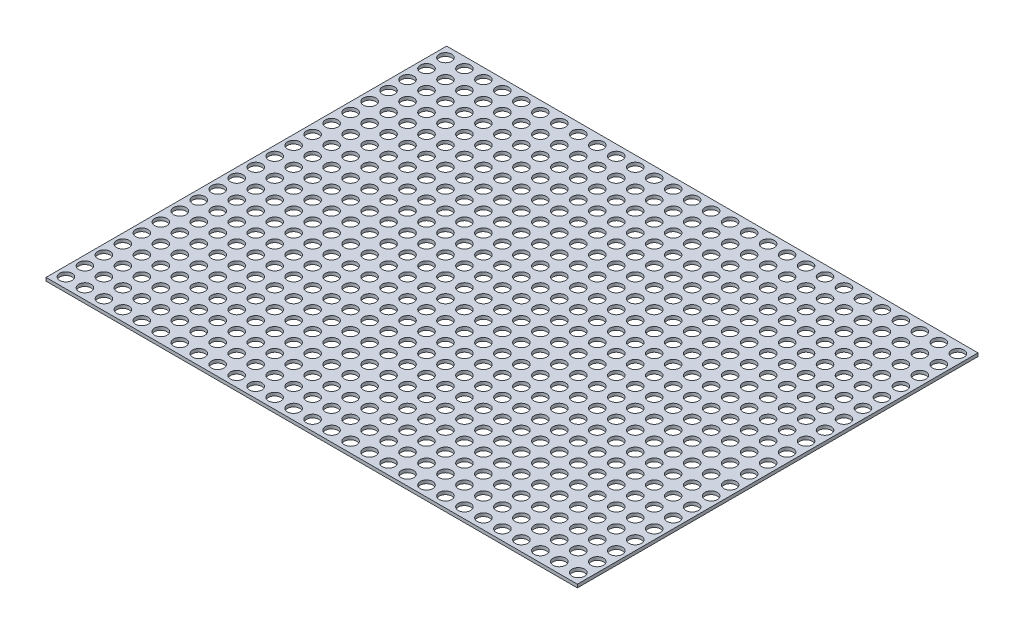
from build123d import *

# Parameters (mm, degrees)
SKETCH1_W           = 252
SKETCH1_H           = 190
SKETCH1_R           = 2.95
BOSS_EXTRUDE1_DEPTH = 1.55


with BuildPart() as part:
    # Sketch1 → Boss-Extrude1 (new body)
    with BuildSketch(Plane(origin=(0, 0, 0), x_dir=(1, 0, 0), z_dir=(0, 1, 0))):
        with Locations((126, 95)):
            Rectangle(SKETCH1_W, SKETCH1_H)
        with Locations((4.5, 4.95)):
            Circle(SKETCH1_R, mode=Mode.SUBTRACT)
        with Locations((13.5, 4.95)):
            Circle(SKETCH1_R, mode=Mode.SUBTRACT)
        with Locations((22.5, 4.95)):
            Circle(SKETCH1_R, mode=Mode.SUBTRACT)
        with Locations((4.5, 13.95)):
            Circle(SKETCH1_R, mode=Mode.SUBTRACT)
        with Locations((13.5, 13.95)):
            Circle(SKETCH1_R, mode=Mode.SUBTRACT)
        with Locations((4.5, 22.95)):
            Circle(SKETCH1_R, mode=Mode.SUBTRACT)
        with Locations((13.5, 22.95)):
            Circle(SKETCH1_R, mode=Mode.SUBTRACT)
        with Locations((22.5, 13.95)):
            Circle(SKETCH1_R, mode=Mode.SUBTRACT)
        with Locations((31.5, 13.95)):
            Circle(SKETCH1_R, mode=Mode.SUBTRACT)
        with Locations((22.5, 22.95)):
            Circle(SKETCH1_R, mode=Mode.SUBTRACT)
        with Locations((31.5, 22.95)):
            Circle(SKETCH1_R, mode=Mode.SUBTRACT)
        with Locations((31.5, 4.95)):
            Circle(SKETCH1_R, mode=Mode.SUBTRACT)
        with Locations((40.5, 4.95)):
            Circle(SKETCH1_R, mode=Mode.SUBTRACT)
        with Locations((49.5, 4.95)):
            Circle(SKETCH1_R, mode=Mode.SUBTRACT)
        with Locations((58.5, 4.95)):
            Circle(SKETCH1_R, mode=Mode.SUBTRACT)
        with Locations((40.5, 13.95)):
            Circle(SKETCH1_R, mode=Mode.SUBTRACT)
        with Locations((40.5, 22.95)):
            Circle(SKETCH1_R, mode=Mode.SUBTRACT)
        with Locations((49.5, 13.95)):
            Circle(SKETCH1_R, mode=Mode.SUBTRACT)
        with Locations((58.5, 13.95)):
            Circle(SKETCH1_R, mode=Mode.SUBTRACT)
        with Locations((49.5, 22.95)):
            Circle(SKETCH1_R, mode=Mode.SUBTRACT)
        with Locations((58.5, 22.95)):
            Circle(SKETCH1_R, mode=Mode.SUBTRACT)
        with Locations((4.5, 31.95)):
            Circle(SKETCH1_R, mode=Mode.SUBTRACT)
        with Locations((13.5, 31.95)):
            Circle(SKETCH1_R, mode=Mode.SUBTRACT)
        with Locations((22.5, 31.95)):
            Circle(SKETCH1_R, mode=Mode.SUBTRACT)
        with Locations((31.5, 31.95)):
            Circle(SKETCH1_R, mode=Mode.SUBTRACT)
        with Locations((4.5, 40.95)):
            Circle(SKETCH1_R, mode=Mode.SUBTRACT)
        with Locations((13.5, 40.95)):
            Circle(SKETCH1_R, mode=Mode.SUBTRACT)
        with Locations((22.5, 40.95)):
            Circle(SKETCH1_R, mode=Mode.SUBTRACT)
        with Locations((31.5, 40.95)):
            Circle(SKETCH1_R, mode=Mode.SUBTRACT)
        with Locations((40.5, 31.95)):
            Circle(SKETCH1_R, mode=Mode.SUBTRACT)
        with Locations((49.5, 31.95)):
            Circle(SKETCH1_R, mode=Mode.SUBTRACT)
        with Locations((58.5, 31.95)):
            Circle(SKETCH1_R, mode=Mode.SUBTRACT)
        with Locations((40.5, 40.95)):
            Circle(SKETCH1_R, mode=Mode.SUBTRACT)
        with Locations((49.5, 40.95)):
            Circle(SKETCH1_R, mode=Mode.SUBTRACT)
        with Locations((58.5, 40.95)):
            Circle(SKETCH1_R, mode=Mode.SUBTRACT)
        with Locations((67.5, 4.95)):
            Circle(SKETCH1_R, mode=Mode.SUBTRACT)
        with Locations((76.5, 4.95)):
            Circle(SKETCH1_R, mode=Mode.SUBTRACT)
        with Locations((85.5, 4.95)):
            Circle(SKETCH1_R, mode=Mode.SUBTRACT)
        with Locations((67.5, 13.95)):
            Circle(SKETCH1_R, mode=Mode.SUBTRACT)
        with Locations((76.5, 13.95)):
            Circle(SKETCH1_R, mode=Mode.SUBTRACT)
        with Locations((67.5, 22.95)):
            Circle(SKETCH1_R, mode=Mode.SUBTRACT)
        with Locations((76.5, 22.95)):
            Circle(SKETCH1_R, mode=Mode.SUBTRACT)
        with Locations((85.5, 13.95)):
            Circle(SKETCH1_R, mode=Mode.SUBTRACT)
        with Locations((94.5, 13.95)):
            Circle(SKETCH1_R, mode=Mode.SUBTRACT)
        with Locations((85.5, 22.95)):
            Circle(SKETCH1_R, mode=Mode.SUBTRACT)
        with Locations((94.5, 22.95)):
            Circle(SKETCH1_R, mode=Mode.SUBTRACT)
        with Locations((94.5, 4.95)):
            Circle(SKETCH1_R, mode=Mode.SUBTRACT)
        with Locations((103.5, 4.95)):
            Circle(SKETCH1_R, mode=Mode.SUBTRACT)
        with Locations((112.5, 4.95)):
            Circle(SKETCH1_R, mode=Mode.SUBTRACT)
        with Locations((121.5, 4.95)):
            Circle(SKETCH1_R, mode=Mode.SUBTRACT)
        with Locations((103.5, 13.95)):
            Circle(SKETCH1_R, mode=Mode.SUBTRACT)
        with Locations((103.5, 22.95)):
            Circle(SKETCH1_R, mode=Mode.SUBTRACT)
        with Locations((112.5, 13.95)):
            Circle(SKETCH1_R, mode=Mode.SUBTRACT)
        with Locations((121.5, 13.95)):
            Circle(SKETCH1_R, mode=Mode.SUBTRACT)
        with Locations((112.5, 22.95)):
            Circle(SKETCH1_R, mode=Mode.SUBTRACT)
        with Locations((121.5, 22.95)):
            Circle(SKETCH1_R, mode=Mode.SUBTRACT)
        with Locations((67.5, 31.95)):
            Circle(SKETCH1_R, mode=Mode.SUBTRACT)
        with Locations((76.5, 31.95)):
            Circle(SKETCH1_R, mode=Mode.SUBTRACT)
        with Locations((85.5, 31.95)):
            Circle(SKETCH1_R, mode=Mode.SUBTRACT)
        with Locations((94.5, 31.95)):
            Circle(SKETCH1_R, mode=Mode.SUBTRACT)
        with Locations((67.5, 40.95)):
            Circle(SKETCH1_R, mode=Mode.SUBTRACT)
        with Locations((76.5, 40.95)):
            Circle(SKETCH1_R, mode=Mode.SUBTRACT)
        with Locations((85.5, 40.95)):
            Circle(SKETCH1_R, mode=Mode.SUBTRACT)
        with Locations((94.5, 40.95)):
            Circle(SKETCH1_R, mode=Mode.SUBTRACT)
        with Locations((103.5, 31.95)):
            Circle(SKETCH1_R, mode=Mode.SUBTRACT)
        with Locations((112.5, 31.95)):
            Circle(SKETCH1_R, mode=Mode.SUBTRACT)
        with Locations((121.5, 31.95)):
            Circle(SKETCH1_R, mode=Mode.SUBTRACT)
        with Locations((103.5, 40.95)):
            Circle(SKETCH1_R, mode=Mode.SUBTRACT)
        with Locations((112.5, 40.95)):
            Circle(SKETCH1_R, mode=Mode.SUBTRACT)
        with Locations((121.5, 40.95)):
            Circle(SKETCH1_R, mode=Mode.SUBTRACT)
        with Locations((4.5, 49.95)):
            Circle(SKETCH1_R, mode=Mode.SUBTRACT)
        with Locations((13.5, 49.95)):
            Circle(SKETCH1_R, mode=Mode.SUBTRACT)
        with Locations((4.5, 58.95)):
            Circle(SKETCH1_R, mode=Mode.SUBTRACT)
        with Locations((13.5, 58.95)):
            Circle(SKETCH1_R, mode=Mode.SUBTRACT)
        with Locations((22.5, 49.95)):
            Circle(SKETCH1_R, mode=Mode.SUBTRACT)
        with Locations((31.5, 49.95)):
            Circle(SKETCH1_R, mode=Mode.SUBTRACT)
        with Locations((22.5, 58.95)):
            Circle(SKETCH1_R, mode=Mode.SUBTRACT)
        with Locations((31.5, 58.95)):
            Circle(SKETCH1_R, mode=Mode.SUBTRACT)
        with Locations((4.5, 67.95)):
            Circle(SKETCH1_R, mode=Mode.SUBTRACT)
        with Locations((13.5, 67.95)):
            Circle(SKETCH1_R, mode=Mode.SUBTRACT)
        with Locations((22.5, 67.95)):
            Circle(SKETCH1_R, mode=Mode.SUBTRACT)
        with Locations((31.5, 67.95)):
            Circle(SKETCH1_R, mode=Mode.SUBTRACT)
        with Locations((40.5, 49.95)):
            Circle(SKETCH1_R, mode=Mode.SUBTRACT)
        with Locations((40.5, 58.95)):
            Circle(SKETCH1_R, mode=Mode.SUBTRACT)
        with Locations((49.5, 49.95)):
            Circle(SKETCH1_R, mode=Mode.SUBTRACT)
        with Locations((58.5, 49.95)):
            Circle(SKETCH1_R, mode=Mode.SUBTRACT)
        with Locations((49.5, 58.95)):
            Circle(SKETCH1_R, mode=Mode.SUBTRACT)
        with Locations((58.5, 58.95)):
            Circle(SKETCH1_R, mode=Mode.SUBTRACT)
        with Locations((40.5, 67.95)):
            Circle(SKETCH1_R, mode=Mode.SUBTRACT)
        with Locations((49.5, 67.95)):
            Circle(SKETCH1_R, mode=Mode.SUBTRACT)
        with Locations((58.5, 67.95)):
            Circle(SKETCH1_R, mode=Mode.SUBTRACT)
        with Locations((4.5, 76.95)):
            Circle(SKETCH1_R, mode=Mode.SUBTRACT)
        with Locations((13.5, 76.95)):
            Circle(SKETCH1_R, mode=Mode.SUBTRACT)
        with Locations((22.5, 76.95)):
            Circle(SKETCH1_R, mode=Mode.SUBTRACT)
        with Locations((31.5, 76.95)):
            Circle(SKETCH1_R, mode=Mode.SUBTRACT)
        with Locations((4.5, 85.95)):
            Circle(SKETCH1_R, mode=Mode.SUBTRACT)
        with Locations((13.5, 85.95)):
            Circle(SKETCH1_R, mode=Mode.SUBTRACT)
        with Locations((4.5, 94.95)):
            Circle(SKETCH1_R, mode=Mode.SUBTRACT)
        with Locations((13.5, 94.95)):
            Circle(SKETCH1_R, mode=Mode.SUBTRACT)
        with Locations((22.5, 85.95)):
            Circle(SKETCH1_R, mode=Mode.SUBTRACT)
        with Locations((31.5, 85.95)):
            Circle(SKETCH1_R, mode=Mode.SUBTRACT)
        with Locations((22.5, 94.95)):
            Circle(SKETCH1_R, mode=Mode.SUBTRACT)
        with Locations((31.5, 94.95)):
            Circle(SKETCH1_R, mode=Mode.SUBTRACT)
        with Locations((40.5, 76.95)):
            Circle(SKETCH1_R, mode=Mode.SUBTRACT)
        with Locations((49.5, 76.95)):
            Circle(SKETCH1_R, mode=Mode.SUBTRACT)
        with Locations((58.5, 76.95)):
            Circle(SKETCH1_R, mode=Mode.SUBTRACT)
        with Locations((40.5, 85.95)):
            Circle(SKETCH1_R, mode=Mode.SUBTRACT)
        with Locations((40.5, 94.95)):
            Circle(SKETCH1_R, mode=Mode.SUBTRACT)
        with Locations((49.5, 85.95)):
            Circle(SKETCH1_R, mode=Mode.SUBTRACT)
        with Locations((58.5, 85.95)):
            Circle(SKETCH1_R, mode=Mode.SUBTRACT)
        with Locations((49.5, 94.95)):
            Circle(SKETCH1_R, mode=Mode.SUBTRACT)
        with Locations((58.5, 94.95)):
            Circle(SKETCH1_R, mode=Mode.SUBTRACT)
        with Locations((67.5, 49.95)):
            Circle(SKETCH1_R, mode=Mode.SUBTRACT)
        with Locations((76.5, 49.95)):
            Circle(SKETCH1_R, mode=Mode.SUBTRACT)
        with Locations((67.5, 58.95)):
            Circle(SKETCH1_R, mode=Mode.SUBTRACT)
        with Locations((76.5, 58.95)):
            Circle(SKETCH1_R, mode=Mode.SUBTRACT)
        with Locations((85.5, 49.95)):
            Circle(SKETCH1_R, mode=Mode.SUBTRACT)
        with Locations((94.5, 49.95)):
            Circle(SKETCH1_R, mode=Mode.SUBTRACT)
        with Locations((85.5, 58.95)):
            Circle(SKETCH1_R, mode=Mode.SUBTRACT)
        with Locations((94.5, 58.95)):
            Circle(SKETCH1_R, mode=Mode.SUBTRACT)
        with Locations((67.5, 67.95)):
            Circle(SKETCH1_R, mode=Mode.SUBTRACT)
        with Locations((76.5, 67.95)):
            Circle(SKETCH1_R, mode=Mode.SUBTRACT)
        with Locations((85.5, 67.95)):
            Circle(SKETCH1_R, mode=Mode.SUBTRACT)
        with Locations((94.5, 67.95)):
            Circle(SKETCH1_R, mode=Mode.SUBTRACT)
        with Locations((103.5, 49.95)):
            Circle(SKETCH1_R, mode=Mode.SUBTRACT)
        with Locations((103.5, 58.95)):
            Circle(SKETCH1_R, mode=Mode.SUBTRACT)
        with Locations((112.5, 49.95)):
            Circle(SKETCH1_R, mode=Mode.SUBTRACT)
        with Locations((121.5, 49.95)):
            Circle(SKETCH1_R, mode=Mode.SUBTRACT)
        with Locations((112.5, 58.95)):
            Circle(SKETCH1_R, mode=Mode.SUBTRACT)
        with Locations((121.5, 58.95)):
            Circle(SKETCH1_R, mode=Mode.SUBTRACT)
        with Locations((103.5, 67.95)):
            Circle(SKETCH1_R, mode=Mode.SUBTRACT)
        with Locations((112.5, 67.95)):
            Circle(SKETCH1_R, mode=Mode.SUBTRACT)
        with Locations((121.5, 67.95)):
            Circle(SKETCH1_R, mode=Mode.SUBTRACT)
        with Locations((67.5, 76.95)):
            Circle(SKETCH1_R, mode=Mode.SUBTRACT)
        with Locations((76.5, 76.95)):
            Circle(SKETCH1_R, mode=Mode.SUBTRACT)
        with Locations((85.5, 76.95)):
            Circle(SKETCH1_R, mode=Mode.SUBTRACT)
        with Locations((94.5, 76.95)):
            Circle(SKETCH1_R, mode=Mode.SUBTRACT)
        with Locations((67.5, 85.95)):
            Circle(SKETCH1_R, mode=Mode.SUBTRACT)
        with Locations((76.5, 85.95)):
            Circle(SKETCH1_R, mode=Mode.SUBTRACT)
        with Locations((67.5, 94.95)):
            Circle(SKETCH1_R, mode=Mode.SUBTRACT)
        with Locations((76.5, 94.95)):
            Circle(SKETCH1_R, mode=Mode.SUBTRACT)
        with Locations((85.5, 85.95)):
            Circle(SKETCH1_R, mode=Mode.SUBTRACT)
        with Locations((94.5, 85.95)):
            Circle(SKETCH1_R, mode=Mode.SUBTRACT)
        with Locations((85.5, 94.95)):
            Circle(SKETCH1_R, mode=Mode.SUBTRACT)
        with Locations((94.5, 94.95)):
            Circle(SKETCH1_R, mode=Mode.SUBTRACT)
        with Locations((103.5, 76.95)):
            Circle(SKETCH1_R, mode=Mode.SUBTRACT)
        with Locations((112.5, 76.95)):
            Circle(SKETCH1_R, mode=Mode.SUBTRACT)
        with Locations((121.5, 76.95)):
            Circle(SKETCH1_R, mode=Mode.SUBTRACT)
        with Locations((103.5, 85.95)):
            Circle(SKETCH1_R, mode=Mode.SUBTRACT)
        with Locations((103.5, 94.95)):
            Circle(SKETCH1_R, mode=Mode.SUBTRACT)
        with Locations((112.5, 85.95)):
            Circle(SKETCH1_R, mode=Mode.SUBTRACT)
        with Locations((121.5, 85.95)):
            Circle(SKETCH1_R, mode=Mode.SUBTRACT)
        with Locations((112.5, 94.95)):
            Circle(SKETCH1_R, mode=Mode.SUBTRACT)
        with Locations((121.5, 94.95)):
            Circle(SKETCH1_R, mode=Mode.SUBTRACT)
        with Locations((130.5, 4.95)):
            Circle(SKETCH1_R, mode=Mode.SUBTRACT)
        with Locations((139.5, 4.95)):
            Circle(SKETCH1_R, mode=Mode.SUBTRACT)
        with Locations((148.5, 4.95)):
            Circle(SKETCH1_R, mode=Mode.SUBTRACT)
        with Locations((130.5, 13.95)):
            Circle(SKETCH1_R, mode=Mode.SUBTRACT)
        with Locations((139.5, 13.95)):
            Circle(SKETCH1_R, mode=Mode.SUBTRACT)
        with Locations((130.5, 22.95)):
            Circle(SKETCH1_R, mode=Mode.SUBTRACT)
        with Locations((139.5, 22.95)):
            Circle(SKETCH1_R, mode=Mode.SUBTRACT)
        with Locations((148.5, 13.95)):
            Circle(SKETCH1_R, mode=Mode.SUBTRACT)
        with Locations((148.5, 22.95)):
            Circle(SKETCH1_R, mode=Mode.SUBTRACT)
        with Locations((157.5, 22.95)):
            Circle(SKETCH1_R, mode=Mode.SUBTRACT)
        with Locations((157.5, 4.95)):
            Circle(SKETCH1_R, mode=Mode.SUBTRACT)
        with Locations((166.5, 4.95)):
            Circle(SKETCH1_R, mode=Mode.SUBTRACT)
        with Locations((175.5, 4.95)):
            Circle(SKETCH1_R, mode=Mode.SUBTRACT)
        with Locations((184.5, 4.95)):
            Circle(SKETCH1_R, mode=Mode.SUBTRACT)
        with Locations((157.5, 13.95)):
            Circle(SKETCH1_R, mode=Mode.SUBTRACT)
        with Locations((166.5, 13.95)):
            Circle(SKETCH1_R, mode=Mode.SUBTRACT)
        with Locations((166.5, 22.95)):
            Circle(SKETCH1_R, mode=Mode.SUBTRACT)
        with Locations((175.5, 13.95)):
            Circle(SKETCH1_R, mode=Mode.SUBTRACT)
        with Locations((184.5, 13.95)):
            Circle(SKETCH1_R, mode=Mode.SUBTRACT)
        with Locations((175.5, 22.95)):
            Circle(SKETCH1_R, mode=Mode.SUBTRACT)
        with Locations((184.5, 22.95)):
            Circle(SKETCH1_R, mode=Mode.SUBTRACT)
        with Locations((130.5, 31.95)):
            Circle(SKETCH1_R, mode=Mode.SUBTRACT)
        with Locations((139.5, 31.95)):
            Circle(SKETCH1_R, mode=Mode.SUBTRACT)
        with Locations((148.5, 31.95)):
            Circle(SKETCH1_R, mode=Mode.SUBTRACT)
        with Locations((157.5, 31.95)):
            Circle(SKETCH1_R, mode=Mode.SUBTRACT)
        with Locations((130.5, 40.95)):
            Circle(SKETCH1_R, mode=Mode.SUBTRACT)
        with Locations((139.5, 40.95)):
            Circle(SKETCH1_R, mode=Mode.SUBTRACT)
        with Locations((148.5, 40.95)):
            Circle(SKETCH1_R, mode=Mode.SUBTRACT)
        with Locations((157.5, 40.95)):
            Circle(SKETCH1_R, mode=Mode.SUBTRACT)
        with Locations((166.5, 31.95)):
            Circle(SKETCH1_R, mode=Mode.SUBTRACT)
        with Locations((175.5, 31.95)):
            Circle(SKETCH1_R, mode=Mode.SUBTRACT)
        with Locations((184.5, 31.95)):
            Circle(SKETCH1_R, mode=Mode.SUBTRACT)
        with Locations((166.5, 40.95)):
            Circle(SKETCH1_R, mode=Mode.SUBTRACT)
        with Locations((175.5, 40.95)):
            Circle(SKETCH1_R, mode=Mode.SUBTRACT)
        with Locations((184.5, 40.95)):
            Circle(SKETCH1_R, mode=Mode.SUBTRACT)
        with Locations((193.5, 4.95)):
            Circle(SKETCH1_R, mode=Mode.SUBTRACT)
        with Locations((202.5, 4.95)):
            Circle(SKETCH1_R, mode=Mode.SUBTRACT)
        with Locations((211.5, 4.95)):
            Circle(SKETCH1_R, mode=Mode.SUBTRACT)
        with Locations((193.5, 13.95)):
            Circle(SKETCH1_R, mode=Mode.SUBTRACT)
        with Locations((202.5, 13.95)):
            Circle(SKETCH1_R, mode=Mode.SUBTRACT)
        with Locations((193.5, 22.95)):
            Circle(SKETCH1_R, mode=Mode.SUBTRACT)
        with Locations((202.5, 22.95)):
            Circle(SKETCH1_R, mode=Mode.SUBTRACT)
        with Locations((211.5, 13.95)):
            Circle(SKETCH1_R, mode=Mode.SUBTRACT)
        with Locations((211.5, 22.95)):
            Circle(SKETCH1_R, mode=Mode.SUBTRACT)
        with Locations((220.5, 22.95)):
            Circle(SKETCH1_R, mode=Mode.SUBTRACT)
        with Locations((220.5, 4.95)):
            Circle(SKETCH1_R, mode=Mode.SUBTRACT)
        with Locations((229.5, 4.95)):
            Circle(SKETCH1_R, mode=Mode.SUBTRACT)
        with Locations((238.5, 4.95)):
            Circle(SKETCH1_R, mode=Mode.SUBTRACT)
        with Locations((247.5, 4.95)):
            Circle(SKETCH1_R, mode=Mode.SUBTRACT)
        with Locations((220.5, 13.95)):
            Circle(SKETCH1_R, mode=Mode.SUBTRACT)
        with Locations((229.5, 13.95)):
            Circle(SKETCH1_R, mode=Mode.SUBTRACT)
        with Locations((229.5, 22.95)):
            Circle(SKETCH1_R, mode=Mode.SUBTRACT)
        with Locations((238.5, 13.95)):
            Circle(SKETCH1_R, mode=Mode.SUBTRACT)
        with Locations((247.5, 13.95)):
            Circle(SKETCH1_R, mode=Mode.SUBTRACT)
        with Locations((238.5, 22.95)):
            Circle(SKETCH1_R, mode=Mode.SUBTRACT)
        with Locations((247.5, 22.95)):
            Circle(SKETCH1_R, mode=Mode.SUBTRACT)
        with Locations((193.5, 31.95)):
            Circle(SKETCH1_R, mode=Mode.SUBTRACT)
        with Locations((202.5, 31.95)):
            Circle(SKETCH1_R, mode=Mode.SUBTRACT)
        with Locations((211.5, 31.95)):
            Circle(SKETCH1_R, mode=Mode.SUBTRACT)
        with Locations((220.5, 31.95)):
            Circle(SKETCH1_R, mode=Mode.SUBTRACT)
        with Locations((193.5, 40.95)):
            Circle(SKETCH1_R, mode=Mode.SUBTRACT)
        with Locations((202.5, 40.95)):
            Circle(SKETCH1_R, mode=Mode.SUBTRACT)
        with Locations((211.5, 40.95)):
            Circle(SKETCH1_R, mode=Mode.SUBTRACT)
        with Locations((220.5, 40.95)):
            Circle(SKETCH1_R, mode=Mode.SUBTRACT)
        with Locations((229.5, 31.95)):
            Circle(SKETCH1_R, mode=Mode.SUBTRACT)
        with Locations((238.5, 31.95)):
            Circle(SKETCH1_R, mode=Mode.SUBTRACT)
        with Locations((247.5, 31.95)):
            Circle(SKETCH1_R, mode=Mode.SUBTRACT)
        with Locations((229.5, 40.95)):
            Circle(SKETCH1_R, mode=Mode.SUBTRACT)
        with Locations((238.5, 40.95)):
            Circle(SKETCH1_R, mode=Mode.SUBTRACT)
        with Locations((247.5, 40.95)):
            Circle(SKETCH1_R, mode=Mode.SUBTRACT)
        with Locations((130.5, 49.95)):
            Circle(SKETCH1_R, mode=Mode.SUBTRACT)
        with Locations((139.5, 49.95)):
            Circle(SKETCH1_R, mode=Mode.SUBTRACT)
        with Locations((130.5, 58.95)):
            Circle(SKETCH1_R, mode=Mode.SUBTRACT)
        with Locations((139.5, 58.95)):
            Circle(SKETCH1_R, mode=Mode.SUBTRACT)
        with Locations((148.5, 49.95)):
            Circle(SKETCH1_R, mode=Mode.SUBTRACT)
        with Locations((157.5, 49.95)):
            Circle(SKETCH1_R, mode=Mode.SUBTRACT)
        with Locations((148.5, 58.95)):
            Circle(SKETCH1_R, mode=Mode.SUBTRACT)
        with Locations((157.5, 58.95)):
            Circle(SKETCH1_R, mode=Mode.SUBTRACT)
        with Locations((130.5, 67.95)):
            Circle(SKETCH1_R, mode=Mode.SUBTRACT)
        with Locations((139.5, 67.95)):
            Circle(SKETCH1_R, mode=Mode.SUBTRACT)
        with Locations((148.5, 67.95)):
            Circle(SKETCH1_R, mode=Mode.SUBTRACT)
        with Locations((157.5, 67.95)):
            Circle(SKETCH1_R, mode=Mode.SUBTRACT)
        with Locations((166.5, 49.95)):
            Circle(SKETCH1_R, mode=Mode.SUBTRACT)
        with Locations((166.5, 58.95)):
            Circle(SKETCH1_R, mode=Mode.SUBTRACT)
        with Locations((175.5, 49.95)):
            Circle(SKETCH1_R, mode=Mode.SUBTRACT)
        with Locations((184.5, 49.95)):
            Circle(SKETCH1_R, mode=Mode.SUBTRACT)
        with Locations((175.5, 58.95)):
            Circle(SKETCH1_R, mode=Mode.SUBTRACT)
        with Locations((184.5, 58.95)):
            Circle(SKETCH1_R, mode=Mode.SUBTRACT)
        with Locations((166.5, 67.95)):
            Circle(SKETCH1_R, mode=Mode.SUBTRACT)
        with Locations((175.5, 67.95)):
            Circle(SKETCH1_R, mode=Mode.SUBTRACT)
        with Locations((184.5, 67.95)):
            Circle(SKETCH1_R, mode=Mode.SUBTRACT)
        with Locations((130.5, 76.95)):
            Circle(SKETCH1_R, mode=Mode.SUBTRACT)
        with Locations((139.5, 76.95)):
            Circle(SKETCH1_R, mode=Mode.SUBTRACT)
        with Locations((148.5, 76.95)):
            Circle(SKETCH1_R, mode=Mode.SUBTRACT)
        with Locations((157.5, 76.95)):
            Circle(SKETCH1_R, mode=Mode.SUBTRACT)
        with Locations((130.5, 85.95)):
            Circle(SKETCH1_R, mode=Mode.SUBTRACT)
        with Locations((139.5, 85.95)):
            Circle(SKETCH1_R, mode=Mode.SUBTRACT)
        with Locations((130.5, 94.95)):
            Circle(SKETCH1_R, mode=Mode.SUBTRACT)
        with Locations((139.5, 94.95)):
            Circle(SKETCH1_R, mode=Mode.SUBTRACT)
        with Locations((148.5, 85.95)):
            Circle(SKETCH1_R, mode=Mode.SUBTRACT)
        with Locations((157.5, 85.95)):
            Circle(SKETCH1_R, mode=Mode.SUBTRACT)
        with Locations((148.5, 94.95)):
            Circle(SKETCH1_R, mode=Mode.SUBTRACT)
        with Locations((157.5, 94.95)):
            Circle(SKETCH1_R, mode=Mode.SUBTRACT)
        with Locations((166.5, 76.95)):
            Circle(SKETCH1_R, mode=Mode.SUBTRACT)
        with Locations((175.5, 76.95)):
            Circle(SKETCH1_R, mode=Mode.SUBTRACT)
        with Locations((184.5, 76.95)):
            Circle(SKETCH1_R, mode=Mode.SUBTRACT)
        with Locations((166.5, 85.95)):
            Circle(SKETCH1_R, mode=Mode.SUBTRACT)
        with Locations((166.5, 94.95)):
            Circle(SKETCH1_R, mode=Mode.SUBTRACT)
        with Locations((175.5, 85.95)):
            Circle(SKETCH1_R, mode=Mode.SUBTRACT)
        with Locations((184.5, 85.95)):
            Circle(SKETCH1_R, mode=Mode.SUBTRACT)
        with Locations((175.5, 94.95)):
            Circle(SKETCH1_R, mode=Mode.SUBTRACT)
        with Locations((184.5, 94.95)):
            Circle(SKETCH1_R, mode=Mode.SUBTRACT)
        with Locations((193.5, 49.95)):
            Circle(SKETCH1_R, mode=Mode.SUBTRACT)
        with Locations((202.5, 49.95)):
            Circle(SKETCH1_R, mode=Mode.SUBTRACT)
        with Locations((193.5, 58.95)):
            Circle(SKETCH1_R, mode=Mode.SUBTRACT)
        with Locations((202.5, 58.95)):
            Circle(SKETCH1_R, mode=Mode.SUBTRACT)
        with Locations((211.5, 49.95)):
            Circle(SKETCH1_R, mode=Mode.SUBTRACT)
        with Locations((220.5, 49.95)):
            Circle(SKETCH1_R, mode=Mode.SUBTRACT)
        with Locations((211.5, 58.95)):
            Circle(SKETCH1_R, mode=Mode.SUBTRACT)
        with Locations((220.5, 58.95)):
            Circle(SKETCH1_R, mode=Mode.SUBTRACT)
        with Locations((193.5, 67.95)):
            Circle(SKETCH1_R, mode=Mode.SUBTRACT)
        with Locations((202.5, 67.95)):
            Circle(SKETCH1_R, mode=Mode.SUBTRACT)
        with Locations((211.5, 67.95)):
            Circle(SKETCH1_R, mode=Mode.SUBTRACT)
        with Locations((220.5, 67.95)):
            Circle(SKETCH1_R, mode=Mode.SUBTRACT)
        with Locations((229.5, 49.95)):
            Circle(SKETCH1_R, mode=Mode.SUBTRACT)
        with Locations((229.5, 58.95)):
            Circle(SKETCH1_R, mode=Mode.SUBTRACT)
        with Locations((238.5, 49.95)):
            Circle(SKETCH1_R, mode=Mode.SUBTRACT)
        with Locations((247.5, 49.95)):
            Circle(SKETCH1_R, mode=Mode.SUBTRACT)
        with Locations((238.5, 58.95)):
            Circle(SKETCH1_R, mode=Mode.SUBTRACT)
        with Locations((247.5, 58.95)):
            Circle(SKETCH1_R, mode=Mode.SUBTRACT)
        with Locations((229.5, 67.95)):
            Circle(SKETCH1_R, mode=Mode.SUBTRACT)
        with Locations((238.5, 67.95)):
            Circle(SKETCH1_R, mode=Mode.SUBTRACT)
        with Locations((247.5, 67.95)):
            Circle(SKETCH1_R, mode=Mode.SUBTRACT)
        with Locations((193.5, 76.95)):
            Circle(SKETCH1_R, mode=Mode.SUBTRACT)
        with Locations((202.5, 76.95)):
            Circle(SKETCH1_R, mode=Mode.SUBTRACT)
        with Locations((211.5, 76.95)):
            Circle(SKETCH1_R, mode=Mode.SUBTRACT)
        with Locations((220.5, 76.95)):
            Circle(SKETCH1_R, mode=Mode.SUBTRACT)
        with Locations((193.5, 85.95)):
            Circle(SKETCH1_R, mode=Mode.SUBTRACT)
        with Locations((202.5, 85.95)):
            Circle(SKETCH1_R, mode=Mode.SUBTRACT)
        with Locations((193.5, 94.95)):
            Circle(SKETCH1_R, mode=Mode.SUBTRACT)
        with Locations((202.5, 94.95)):
            Circle(SKETCH1_R, mode=Mode.SUBTRACT)
        with Locations((211.5, 85.95)):
            Circle(SKETCH1_R, mode=Mode.SUBTRACT)
        with Locations((220.5, 85.95)):
            Circle(SKETCH1_R, mode=Mode.SUBTRACT)
        with Locations((211.5, 94.95)):
            Circle(SKETCH1_R, mode=Mode.SUBTRACT)
        with Locations((220.5, 94.95)):
            Circle(SKETCH1_R, mode=Mode.SUBTRACT)
        with Locations((229.5, 76.95)):
            Circle(SKETCH1_R, mode=Mode.SUBTRACT)
        with Locations((238.5, 76.95)):
            Circle(SKETCH1_R, mode=Mode.SUBTRACT)
        with Locations((247.5, 76.95)):
            Circle(SKETCH1_R, mode=Mode.SUBTRACT)
        with Locations((229.5, 85.95)):
            Circle(SKETCH1_R, mode=Mode.SUBTRACT)
        with Locations((229.5, 94.95)):
            Circle(SKETCH1_R, mode=Mode.SUBTRACT)
        with Locations((238.5, 85.95)):
            Circle(SKETCH1_R, mode=Mode.SUBTRACT)
        with Locations((247.5, 85.95)):
            Circle(SKETCH1_R, mode=Mode.SUBTRACT)
        with Locations((238.5, 94.95)):
            Circle(SKETCH1_R, mode=Mode.SUBTRACT)
        with Locations((247.5, 94.95)):
            Circle(SKETCH1_R, mode=Mode.SUBTRACT)
        with Locations((4.5, 103.95)):
            Circle(SKETCH1_R, mode=Mode.SUBTRACT)
        with Locations((13.5, 103.95)):
            Circle(SKETCH1_R, mode=Mode.SUBTRACT)
        with Locations((22.5, 103.95)):
            Circle(SKETCH1_R, mode=Mode.SUBTRACT)
        with Locations((31.5, 103.95)):
            Circle(SKETCH1_R, mode=Mode.SUBTRACT)
        with Locations((4.5, 112.95)):
            Circle(SKETCH1_R, mode=Mode.SUBTRACT)
        with Locations((13.5, 112.95)):
            Circle(SKETCH1_R, mode=Mode.SUBTRACT)
        with Locations((22.5, 112.95)):
            Circle(SKETCH1_R, mode=Mode.SUBTRACT)
        with Locations((31.5, 112.95)):
            Circle(SKETCH1_R, mode=Mode.SUBTRACT)
        with Locations((40.5, 103.95)):
            Circle(SKETCH1_R, mode=Mode.SUBTRACT)
        with Locations((49.5, 103.95)):
            Circle(SKETCH1_R, mode=Mode.SUBTRACT)
        with Locations((58.5, 103.95)):
            Circle(SKETCH1_R, mode=Mode.SUBTRACT)
        with Locations((40.5, 112.95)):
            Circle(SKETCH1_R, mode=Mode.SUBTRACT)
        with Locations((49.5, 112.95)):
            Circle(SKETCH1_R, mode=Mode.SUBTRACT)
        with Locations((58.5, 112.95)):
            Circle(SKETCH1_R, mode=Mode.SUBTRACT)
        with Locations((4.5, 121.95)):
            Circle(SKETCH1_R, mode=Mode.SUBTRACT)
        with Locations((13.5, 121.95)):
            Circle(SKETCH1_R, mode=Mode.SUBTRACT)
        with Locations((22.5, 121.95)):
            Circle(SKETCH1_R, mode=Mode.SUBTRACT)
        with Locations((31.5, 121.95)):
            Circle(SKETCH1_R, mode=Mode.SUBTRACT)
        with Locations((4.5, 130.95)):
            Circle(SKETCH1_R, mode=Mode.SUBTRACT)
        with Locations((13.5, 130.95)):
            Circle(SKETCH1_R, mode=Mode.SUBTRACT)
        with Locations((4.5, 139.95)):
            Circle(SKETCH1_R, mode=Mode.SUBTRACT)
        with Locations((13.5, 139.95)):
            Circle(SKETCH1_R, mode=Mode.SUBTRACT)
        with Locations((22.5, 130.95)):
            Circle(SKETCH1_R, mode=Mode.SUBTRACT)
        with Locations((31.5, 130.95)):
            Circle(SKETCH1_R, mode=Mode.SUBTRACT)
        with Locations((22.5, 139.95)):
            Circle(SKETCH1_R, mode=Mode.SUBTRACT)
        with Locations((31.5, 139.95)):
            Circle(SKETCH1_R, mode=Mode.SUBTRACT)
        with Locations((40.5, 121.95)):
            Circle(SKETCH1_R, mode=Mode.SUBTRACT)
        with Locations((49.5, 121.95)):
            Circle(SKETCH1_R, mode=Mode.SUBTRACT)
        with Locations((58.5, 121.95)):
            Circle(SKETCH1_R, mode=Mode.SUBTRACT)
        with Locations((40.5, 130.95)):
            Circle(SKETCH1_R, mode=Mode.SUBTRACT)
        with Locations((40.5, 139.95)):
            Circle(SKETCH1_R, mode=Mode.SUBTRACT)
        with Locations((49.5, 130.95)):
            Circle(SKETCH1_R, mode=Mode.SUBTRACT)
        with Locations((58.5, 130.95)):
            Circle(SKETCH1_R, mode=Mode.SUBTRACT)
        with Locations((49.5, 139.95)):
            Circle(SKETCH1_R, mode=Mode.SUBTRACT)
        with Locations((58.5, 139.95)):
            Circle(SKETCH1_R, mode=Mode.SUBTRACT)
        with Locations((67.5, 103.95)):
            Circle(SKETCH1_R, mode=Mode.SUBTRACT)
        with Locations((76.5, 103.95)):
            Circle(SKETCH1_R, mode=Mode.SUBTRACT)
        with Locations((85.5, 103.95)):
            Circle(SKETCH1_R, mode=Mode.SUBTRACT)
        with Locations((94.5, 103.95)):
            Circle(SKETCH1_R, mode=Mode.SUBTRACT)
        with Locations((67.5, 112.95)):
            Circle(SKETCH1_R, mode=Mode.SUBTRACT)
        with Locations((76.5, 112.95)):
            Circle(SKETCH1_R, mode=Mode.SUBTRACT)
        with Locations((85.5, 112.95)):
            Circle(SKETCH1_R, mode=Mode.SUBTRACT)
        with Locations((94.5, 112.95)):
            Circle(SKETCH1_R, mode=Mode.SUBTRACT)
        with Locations((103.5, 103.95)):
            Circle(SKETCH1_R, mode=Mode.SUBTRACT)
        with Locations((112.5, 103.95)):
            Circle(SKETCH1_R, mode=Mode.SUBTRACT)
        with Locations((121.5, 103.95)):
            Circle(SKETCH1_R, mode=Mode.SUBTRACT)
        with Locations((103.5, 112.95)):
            Circle(SKETCH1_R, mode=Mode.SUBTRACT)
        with Locations((112.5, 112.95)):
            Circle(SKETCH1_R, mode=Mode.SUBTRACT)
        with Locations((121.5, 112.95)):
            Circle(SKETCH1_R, mode=Mode.SUBTRACT)
        with Locations((67.5, 121.95)):
            Circle(SKETCH1_R, mode=Mode.SUBTRACT)
        with Locations((76.5, 121.95)):
            Circle(SKETCH1_R, mode=Mode.SUBTRACT)
        with Locations((85.5, 121.95)):
            Circle(SKETCH1_R, mode=Mode.SUBTRACT)
        with Locations((94.5, 121.95)):
            Circle(SKETCH1_R, mode=Mode.SUBTRACT)
        with Locations((67.5, 130.95)):
            Circle(SKETCH1_R, mode=Mode.SUBTRACT)
        with Locations((76.5, 130.95)):
            Circle(SKETCH1_R, mode=Mode.SUBTRACT)
        with Locations((67.5, 139.95)):
            Circle(SKETCH1_R, mode=Mode.SUBTRACT)
        with Locations((76.5, 139.95)):
            Circle(SKETCH1_R, mode=Mode.SUBTRACT)
        with Locations((85.5, 130.95)):
            Circle(SKETCH1_R, mode=Mode.SUBTRACT)
        with Locations((94.5, 130.95)):
            Circle(SKETCH1_R, mode=Mode.SUBTRACT)
        with Locations((85.5, 139.95)):
            Circle(SKETCH1_R, mode=Mode.SUBTRACT)
        with Locations((94.5, 139.95)):
            Circle(SKETCH1_R, mode=Mode.SUBTRACT)
        with Locations((103.5, 121.95)):
            Circle(SKETCH1_R, mode=Mode.SUBTRACT)
        with Locations((112.5, 121.95)):
            Circle(SKETCH1_R, mode=Mode.SUBTRACT)
        with Locations((121.5, 121.95)):
            Circle(SKETCH1_R, mode=Mode.SUBTRACT)
        with Locations((103.5, 130.95)):
            Circle(SKETCH1_R, mode=Mode.SUBTRACT)
        with Locations((103.5, 139.95)):
            Circle(SKETCH1_R, mode=Mode.SUBTRACT)
        with Locations((112.5, 130.95)):
            Circle(SKETCH1_R, mode=Mode.SUBTRACT)
        with Locations((121.5, 130.95)):
            Circle(SKETCH1_R, mode=Mode.SUBTRACT)
        with Locations((112.5, 139.95)):
            Circle(SKETCH1_R, mode=Mode.SUBTRACT)
        with Locations((121.5, 139.95)):
            Circle(SKETCH1_R, mode=Mode.SUBTRACT)
        with Locations((4.5, 148.95)):
            Circle(SKETCH1_R, mode=Mode.SUBTRACT)
        with Locations((13.5, 148.95)):
            Circle(SKETCH1_R, mode=Mode.SUBTRACT)
        with Locations((22.5, 148.95)):
            Circle(SKETCH1_R, mode=Mode.SUBTRACT)
        with Locations((31.5, 148.95)):
            Circle(SKETCH1_R, mode=Mode.SUBTRACT)
        with Locations((4.5, 157.95)):
            Circle(SKETCH1_R, mode=Mode.SUBTRACT)
        with Locations((13.5, 157.95)):
            Circle(SKETCH1_R, mode=Mode.SUBTRACT)
        with Locations((22.5, 157.95)):
            Circle(SKETCH1_R, mode=Mode.SUBTRACT)
        with Locations((31.5, 157.95)):
            Circle(SKETCH1_R, mode=Mode.SUBTRACT)
        with Locations((40.5, 148.95)):
            Circle(SKETCH1_R, mode=Mode.SUBTRACT)
        with Locations((49.5, 148.95)):
            Circle(SKETCH1_R, mode=Mode.SUBTRACT)
        with Locations((58.5, 148.95)):
            Circle(SKETCH1_R, mode=Mode.SUBTRACT)
        with Locations((40.5, 157.95)):
            Circle(SKETCH1_R, mode=Mode.SUBTRACT)
        with Locations((49.5, 157.95)):
            Circle(SKETCH1_R, mode=Mode.SUBTRACT)
        with Locations((58.5, 157.95)):
            Circle(SKETCH1_R, mode=Mode.SUBTRACT)
        with Locations((4.5, 166.95)):
            Circle(SKETCH1_R, mode=Mode.SUBTRACT)
        with Locations((13.5, 166.95)):
            Circle(SKETCH1_R, mode=Mode.SUBTRACT)
        with Locations((4.5, 175.95)):
            Circle(SKETCH1_R, mode=Mode.SUBTRACT)
        with Locations((13.5, 175.95)):
            Circle(SKETCH1_R, mode=Mode.SUBTRACT)
        with Locations((22.5, 166.95)):
            Circle(SKETCH1_R, mode=Mode.SUBTRACT)
        with Locations((31.5, 166.95)):
            Circle(SKETCH1_R, mode=Mode.SUBTRACT)
        with Locations((22.5, 175.95)):
            Circle(SKETCH1_R, mode=Mode.SUBTRACT)
        with Locations((31.5, 175.95)):
            Circle(SKETCH1_R, mode=Mode.SUBTRACT)
        with Locations((4.5, 184.95)):
            Circle(SKETCH1_R, mode=Mode.SUBTRACT)
        with Locations((13.5, 184.95)):
            Circle(SKETCH1_R, mode=Mode.SUBTRACT)
        with Locations((22.5, 184.95)):
            Circle(SKETCH1_R, mode=Mode.SUBTRACT)
        with Locations((31.5, 184.95)):
            Circle(SKETCH1_R, mode=Mode.SUBTRACT)
        with Locations((40.5, 166.95)):
            Circle(SKETCH1_R, mode=Mode.SUBTRACT)
        with Locations((40.5, 175.95)):
            Circle(SKETCH1_R, mode=Mode.SUBTRACT)
        with Locations((49.5, 166.95)):
            Circle(SKETCH1_R, mode=Mode.SUBTRACT)
        with Locations((58.5, 166.95)):
            Circle(SKETCH1_R, mode=Mode.SUBTRACT)
        with Locations((49.5, 175.95)):
            Circle(SKETCH1_R, mode=Mode.SUBTRACT)
        with Locations((58.5, 175.95)):
            Circle(SKETCH1_R, mode=Mode.SUBTRACT)
        with Locations((40.5, 184.95)):
            Circle(SKETCH1_R, mode=Mode.SUBTRACT)
        with Locations((49.5, 184.95)):
            Circle(SKETCH1_R, mode=Mode.SUBTRACT)
        with Locations((58.5, 184.95)):
            Circle(SKETCH1_R, mode=Mode.SUBTRACT)
        with Locations((67.5, 148.95)):
            Circle(SKETCH1_R, mode=Mode.SUBTRACT)
        with Locations((76.5, 148.95)):
            Circle(SKETCH1_R, mode=Mode.SUBTRACT)
        with Locations((85.5, 148.95)):
            Circle(SKETCH1_R, mode=Mode.SUBTRACT)
        with Locations((94.5, 148.95)):
            Circle(SKETCH1_R, mode=Mode.SUBTRACT)
        with Locations((67.5, 157.95)):
            Circle(SKETCH1_R, mode=Mode.SUBTRACT)
        with Locations((76.5, 157.95)):
            Circle(SKETCH1_R, mode=Mode.SUBTRACT)
        with Locations((85.5, 157.95)):
            Circle(SKETCH1_R, mode=Mode.SUBTRACT)
        with Locations((94.5, 157.95)):
            Circle(SKETCH1_R, mode=Mode.SUBTRACT)
        with Locations((103.5, 148.95)):
            Circle(SKETCH1_R, mode=Mode.SUBTRACT)
        with Locations((112.5, 148.95)):
            Circle(SKETCH1_R, mode=Mode.SUBTRACT)
        with Locations((121.5, 148.95)):
            Circle(SKETCH1_R, mode=Mode.SUBTRACT)
        with Locations((103.5, 157.95)):
            Circle(SKETCH1_R, mode=Mode.SUBTRACT)
        with Locations((112.5, 157.95)):
            Circle(SKETCH1_R, mode=Mode.SUBTRACT)
        with Locations((121.5, 157.95)):
            Circle(SKETCH1_R, mode=Mode.SUBTRACT)
        with Locations((67.5, 166.95)):
            Circle(SKETCH1_R, mode=Mode.SUBTRACT)
        with Locations((76.5, 166.95)):
            Circle(SKETCH1_R, mode=Mode.SUBTRACT)
        with Locations((67.5, 175.95)):
            Circle(SKETCH1_R, mode=Mode.SUBTRACT)
        with Locations((76.5, 175.95)):
            Circle(SKETCH1_R, mode=Mode.SUBTRACT)
        with Locations((85.5, 166.95)):
            Circle(SKETCH1_R, mode=Mode.SUBTRACT)
        with Locations((94.5, 166.95)):
            Circle(SKETCH1_R, mode=Mode.SUBTRACT)
        with Locations((85.5, 175.95)):
            Circle(SKETCH1_R, mode=Mode.SUBTRACT)
        with Locations((94.5, 175.95)):
            Circle(SKETCH1_R, mode=Mode.SUBTRACT)
        with Locations((67.5, 184.95)):
            Circle(SKETCH1_R, mode=Mode.SUBTRACT)
        with Locations((76.5, 184.95)):
            Circle(SKETCH1_R, mode=Mode.SUBTRACT)
        with Locations((85.5, 184.95)):
            Circle(SKETCH1_R, mode=Mode.SUBTRACT)
        with Locations((94.5, 184.95)):
            Circle(SKETCH1_R, mode=Mode.SUBTRACT)
        with Locations((103.5, 166.95)):
            Circle(SKETCH1_R, mode=Mode.SUBTRACT)
        with Locations((103.5, 175.95)):
            Circle(SKETCH1_R, mode=Mode.SUBTRACT)
        with Locations((112.5, 166.95)):
            Circle(SKETCH1_R, mode=Mode.SUBTRACT)
        with Locations((121.5, 166.95)):
            Circle(SKETCH1_R, mode=Mode.SUBTRACT)
        with Locations((112.5, 175.95)):
            Circle(SKETCH1_R, mode=Mode.SUBTRACT)
        with Locations((121.5, 175.95)):
            Circle(SKETCH1_R, mode=Mode.SUBTRACT)
        with Locations((103.5, 184.95)):
            Circle(SKETCH1_R, mode=Mode.SUBTRACT)
        with Locations((112.5, 184.95)):
            Circle(SKETCH1_R, mode=Mode.SUBTRACT)
        with Locations((121.5, 184.95)):
            Circle(SKETCH1_R, mode=Mode.SUBTRACT)
        with Locations((130.5, 103.95)):
            Circle(SKETCH1_R, mode=Mode.SUBTRACT)
        with Locations((139.5, 103.95)):
            Circle(SKETCH1_R, mode=Mode.SUBTRACT)
        with Locations((148.5, 103.95)):
            Circle(SKETCH1_R, mode=Mode.SUBTRACT)
        with Locations((157.5, 103.95)):
            Circle(SKETCH1_R, mode=Mode.SUBTRACT)
        with Locations((130.5, 112.95)):
            Circle(SKETCH1_R, mode=Mode.SUBTRACT)
        with Locations((139.5, 112.95)):
            Circle(SKETCH1_R, mode=Mode.SUBTRACT)
        with Locations((148.5, 112.95)):
            Circle(SKETCH1_R, mode=Mode.SUBTRACT)
        with Locations((157.5, 112.95)):
            Circle(SKETCH1_R, mode=Mode.SUBTRACT)
        with Locations((166.5, 103.95)):
            Circle(SKETCH1_R, mode=Mode.SUBTRACT)
        with Locations((175.5, 103.95)):
            Circle(SKETCH1_R, mode=Mode.SUBTRACT)
        with Locations((184.5, 103.95)):
            Circle(SKETCH1_R, mode=Mode.SUBTRACT)
        with Locations((166.5, 112.95)):
            Circle(SKETCH1_R, mode=Mode.SUBTRACT)
        with Locations((175.5, 112.95)):
            Circle(SKETCH1_R, mode=Mode.SUBTRACT)
        with Locations((184.5, 112.95)):
            Circle(SKETCH1_R, mode=Mode.SUBTRACT)
        with Locations((130.5, 121.95)):
            Circle(SKETCH1_R, mode=Mode.SUBTRACT)
        with Locations((139.5, 121.95)):
            Circle(SKETCH1_R, mode=Mode.SUBTRACT)
        with Locations((148.5, 121.95)):
            Circle(SKETCH1_R, mode=Mode.SUBTRACT)
        with Locations((157.5, 121.95)):
            Circle(SKETCH1_R, mode=Mode.SUBTRACT)
        with Locations((130.5, 130.95)):
            Circle(SKETCH1_R, mode=Mode.SUBTRACT)
        with Locations((139.5, 130.95)):
            Circle(SKETCH1_R, mode=Mode.SUBTRACT)
        with Locations((130.5, 139.95)):
            Circle(SKETCH1_R, mode=Mode.SUBTRACT)
        with Locations((139.5, 139.95)):
            Circle(SKETCH1_R, mode=Mode.SUBTRACT)
        with Locations((148.5, 130.95)):
            Circle(SKETCH1_R, mode=Mode.SUBTRACT)
        with Locations((157.5, 130.95)):
            Circle(SKETCH1_R, mode=Mode.SUBTRACT)
        with Locations((148.5, 139.95)):
            Circle(SKETCH1_R, mode=Mode.SUBTRACT)
        with Locations((157.5, 139.95)):
            Circle(SKETCH1_R, mode=Mode.SUBTRACT)
        with Locations((166.5, 121.95)):
            Circle(SKETCH1_R, mode=Mode.SUBTRACT)
        with Locations((175.5, 121.95)):
            Circle(SKETCH1_R, mode=Mode.SUBTRACT)
        with Locations((184.5, 121.95)):
            Circle(SKETCH1_R, mode=Mode.SUBTRACT)
        with Locations((166.5, 130.95)):
            Circle(SKETCH1_R, mode=Mode.SUBTRACT)
        with Locations((166.5, 139.95)):
            Circle(SKETCH1_R, mode=Mode.SUBTRACT)
        with Locations((175.5, 130.95)):
            Circle(SKETCH1_R, mode=Mode.SUBTRACT)
        with Locations((184.5, 130.95)):
            Circle(SKETCH1_R, mode=Mode.SUBTRACT)
        with Locations((175.5, 139.95)):
            Circle(SKETCH1_R, mode=Mode.SUBTRACT)
        with Locations((184.5, 139.95)):
            Circle(SKETCH1_R, mode=Mode.SUBTRACT)
        with Locations((193.5, 103.95)):
            Circle(SKETCH1_R, mode=Mode.SUBTRACT)
        with Locations((202.5, 103.95)):
            Circle(SKETCH1_R, mode=Mode.SUBTRACT)
        with Locations((211.5, 103.95)):
            Circle(SKETCH1_R, mode=Mode.SUBTRACT)
        with Locations((220.5, 103.95)):
            Circle(SKETCH1_R, mode=Mode.SUBTRACT)
        with Locations((193.5, 112.95)):
            Circle(SKETCH1_R, mode=Mode.SUBTRACT)
        with Locations((202.5, 112.95)):
            Circle(SKETCH1_R, mode=Mode.SUBTRACT)
        with Locations((211.5, 112.95)):
            Circle(SKETCH1_R, mode=Mode.SUBTRACT)
        with Locations((220.5, 112.95)):
            Circle(SKETCH1_R, mode=Mode.SUBTRACT)
        with Locations((229.5, 103.95)):
            Circle(SKETCH1_R, mode=Mode.SUBTRACT)
        with Locations((238.5, 103.95)):
            Circle(SKETCH1_R, mode=Mode.SUBTRACT)
        with Locations((247.5, 103.95)):
            Circle(SKETCH1_R, mode=Mode.SUBTRACT)
        with Locations((229.5, 112.95)):
            Circle(SKETCH1_R, mode=Mode.SUBTRACT)
        with Locations((238.5, 112.95)):
            Circle(SKETCH1_R, mode=Mode.SUBTRACT)
        with Locations((247.5, 112.95)):
            Circle(SKETCH1_R, mode=Mode.SUBTRACT)
        with Locations((193.5, 121.95)):
            Circle(SKETCH1_R, mode=Mode.SUBTRACT)
        with Locations((202.5, 121.95)):
            Circle(SKETCH1_R, mode=Mode.SUBTRACT)
        with Locations((211.5, 121.95)):
            Circle(SKETCH1_R, mode=Mode.SUBTRACT)
        with Locations((220.5, 121.95)):
            Circle(SKETCH1_R, mode=Mode.SUBTRACT)
        with Locations((193.5, 130.95)):
            Circle(SKETCH1_R, mode=Mode.SUBTRACT)
        with Locations((202.5, 130.95)):
            Circle(SKETCH1_R, mode=Mode.SUBTRACT)
        with Locations((193.5, 139.95)):
            Circle(SKETCH1_R, mode=Mode.SUBTRACT)
        with Locations((202.5, 139.95)):
            Circle(SKETCH1_R, mode=Mode.SUBTRACT)
        with Locations((211.5, 130.95)):
            Circle(SKETCH1_R, mode=Mode.SUBTRACT)
        with Locations((220.5, 130.95)):
            Circle(SKETCH1_R, mode=Mode.SUBTRACT)
        with Locations((211.5, 139.95)):
            Circle(SKETCH1_R, mode=Mode.SUBTRACT)
        with Locations((220.5, 139.95)):
            Circle(SKETCH1_R, mode=Mode.SUBTRACT)
        with Locations((229.5, 121.95)):
            Circle(SKETCH1_R, mode=Mode.SUBTRACT)
        with Locations((238.5, 121.95)):
            Circle(SKETCH1_R, mode=Mode.SUBTRACT)
        with Locations((247.5, 121.95)):
            Circle(SKETCH1_R, mode=Mode.SUBTRACT)
        with Locations((229.5, 130.95)):
            Circle(SKETCH1_R, mode=Mode.SUBTRACT)
        with Locations((229.5, 139.95)):
            Circle(SKETCH1_R, mode=Mode.SUBTRACT)
        with Locations((238.5, 130.95)):
            Circle(SKETCH1_R, mode=Mode.SUBTRACT)
        with Locations((247.5, 130.95)):
            Circle(SKETCH1_R, mode=Mode.SUBTRACT)
        with Locations((238.5, 139.95)):
            Circle(SKETCH1_R, mode=Mode.SUBTRACT)
        with Locations((247.5, 139.95)):
            Circle(SKETCH1_R, mode=Mode.SUBTRACT)
        with Locations((130.5, 148.95)):
            Circle(SKETCH1_R, mode=Mode.SUBTRACT)
        with Locations((139.5, 148.95)):
            Circle(SKETCH1_R, mode=Mode.SUBTRACT)
        with Locations((148.5, 148.95)):
            Circle(SKETCH1_R, mode=Mode.SUBTRACT)
        with Locations((157.5, 148.95)):
            Circle(SKETCH1_R, mode=Mode.SUBTRACT)
        with Locations((130.5, 157.95)):
            Circle(SKETCH1_R, mode=Mode.SUBTRACT)
        with Locations((139.5, 157.95)):
            Circle(SKETCH1_R, mode=Mode.SUBTRACT)
        with Locations((148.5, 157.95)):
            Circle(SKETCH1_R, mode=Mode.SUBTRACT)
        with Locations((157.5, 157.95)):
            Circle(SKETCH1_R, mode=Mode.SUBTRACT)
        with Locations((166.5, 148.95)):
            Circle(SKETCH1_R, mode=Mode.SUBTRACT)
        with Locations((175.5, 148.95)):
            Circle(SKETCH1_R, mode=Mode.SUBTRACT)
        with Locations((184.5, 148.95)):
            Circle(SKETCH1_R, mode=Mode.SUBTRACT)
        with Locations((166.5, 157.95)):
            Circle(SKETCH1_R, mode=Mode.SUBTRACT)
        with Locations((175.5, 157.95)):
            Circle(SKETCH1_R, mode=Mode.SUBTRACT)
        with Locations((184.5, 157.95)):
            Circle(SKETCH1_R, mode=Mode.SUBTRACT)
        with Locations((130.5, 166.95)):
            Circle(SKETCH1_R, mode=Mode.SUBTRACT)
        with Locations((139.5, 166.95)):
            Circle(SKETCH1_R, mode=Mode.SUBTRACT)
        with Locations((130.5, 175.95)):
            Circle(SKETCH1_R, mode=Mode.SUBTRACT)
        with Locations((139.5, 175.95)):
            Circle(SKETCH1_R, mode=Mode.SUBTRACT)
        with Locations((148.5, 166.95)):
            Circle(SKETCH1_R, mode=Mode.SUBTRACT)
        with Locations((157.5, 166.95)):
            Circle(SKETCH1_R, mode=Mode.SUBTRACT)
        with Locations((148.5, 175.95)):
            Circle(SKETCH1_R, mode=Mode.SUBTRACT)
        with Locations((157.5, 175.95)):
            Circle(SKETCH1_R, mode=Mode.SUBTRACT)
        with Locations((130.5, 184.95)):
            Circle(SKETCH1_R, mode=Mode.SUBTRACT)
        with Locations((139.5, 184.95)):
            Circle(SKETCH1_R, mode=Mode.SUBTRACT)
        with Locations((148.5, 184.95)):
            Circle(SKETCH1_R, mode=Mode.SUBTRACT)
        with Locations((157.5, 184.95)):
            Circle(SKETCH1_R, mode=Mode.SUBTRACT)
        with Locations((166.5, 166.95)):
            Circle(SKETCH1_R, mode=Mode.SUBTRACT)
        with Locations((166.5, 175.95)):
            Circle(SKETCH1_R, mode=Mode.SUBTRACT)
        with Locations((175.5, 166.95)):
            Circle(SKETCH1_R, mode=Mode.SUBTRACT)
        with Locations((184.5, 166.95)):
            Circle(SKETCH1_R, mode=Mode.SUBTRACT)
        with Locations((175.5, 175.95)):
            Circle(SKETCH1_R, mode=Mode.SUBTRACT)
        with Locations((184.5, 175.95)):
            Circle(SKETCH1_R, mode=Mode.SUBTRACT)
        with Locations((166.5, 184.95)):
            Circle(SKETCH1_R, mode=Mode.SUBTRACT)
        with Locations((175.5, 184.95)):
            Circle(SKETCH1_R, mode=Mode.SUBTRACT)
        with Locations((184.5, 184.95)):
            Circle(SKETCH1_R, mode=Mode.SUBTRACT)
        with Locations((193.5, 148.95)):
            Circle(SKETCH1_R, mode=Mode.SUBTRACT)
        with Locations((202.5, 148.95)):
            Circle(SKETCH1_R, mode=Mode.SUBTRACT)
        with Locations((211.5, 148.95)):
            Circle(SKETCH1_R, mode=Mode.SUBTRACT)
        with Locations((220.5, 148.95)):
            Circle(SKETCH1_R, mode=Mode.SUBTRACT)
        with Locations((193.5, 157.95)):
            Circle(SKETCH1_R, mode=Mode.SUBTRACT)
        with Locations((202.5, 157.95)):
            Circle(SKETCH1_R, mode=Mode.SUBTRACT)
        with Locations((211.5, 157.95)):
            Circle(SKETCH1_R, mode=Mode.SUBTRACT)
        with Locations((220.5, 157.95)):
            Circle(SKETCH1_R, mode=Mode.SUBTRACT)
        with Locations((229.5, 148.95)):
            Circle(SKETCH1_R, mode=Mode.SUBTRACT)
        with Locations((238.5, 148.95)):
            Circle(SKETCH1_R, mode=Mode.SUBTRACT)
        with Locations((247.5, 148.95)):
            Circle(SKETCH1_R, mode=Mode.SUBTRACT)
        with Locations((229.5, 157.95)):
            Circle(SKETCH1_R, mode=Mode.SUBTRACT)
        with Locations((238.5, 157.95)):
            Circle(SKETCH1_R, mode=Mode.SUBTRACT)
        with Locations((247.5, 157.95)):
            Circle(SKETCH1_R, mode=Mode.SUBTRACT)
        with Locations((193.5, 166.95)):
            Circle(SKETCH1_R, mode=Mode.SUBTRACT)
        with Locations((202.5, 166.95)):
            Circle(SKETCH1_R, mode=Mode.SUBTRACT)
        with Locations((193.5, 175.95)):
            Circle(SKETCH1_R, mode=Mode.SUBTRACT)
        with Locations((202.5, 175.95)):
            Circle(SKETCH1_R, mode=Mode.SUBTRACT)
        with Locations((211.5, 166.95)):
            Circle(SKETCH1_R, mode=Mode.SUBTRACT)
        with Locations((220.5, 166.95)):
            Circle(SKETCH1_R, mode=Mode.SUBTRACT)
        with Locations((211.5, 175.95)):
            Circle(SKETCH1_R, mode=Mode.SUBTRACT)
        with Locations((220.5, 175.95)):
            Circle(SKETCH1_R, mode=Mode.SUBTRACT)
        with Locations((193.5, 184.95)):
            Circle(SKETCH1_R, mode=Mode.SUBTRACT)
        with Locations((202.5, 184.95)):
            Circle(SKETCH1_R, mode=Mode.SUBTRACT)
        with Locations((211.5, 184.95)):
            Circle(SKETCH1_R, mode=Mode.SUBTRACT)
        with Locations((220.5, 184.95)):
            Circle(SKETCH1_R, mode=Mode.SUBTRACT)
        with Locations((229.5, 166.95)):
            Circle(SKETCH1_R, mode=Mode.SUBTRACT)
        with Locations((229.5, 175.95)):
            Circle(SKETCH1_R, mode=Mode.SUBTRACT)
        with Locations((238.5, 166.95)):
            Circle(SKETCH1_R, mode=Mode.SUBTRACT)
        with Locations((247.5, 166.95)):
            Circle(SKETCH1_R, mode=Mode.SUBTRACT)
        with Locations((238.5, 175.95)):
            Circle(SKETCH1_R, mode=Mode.SUBTRACT)
        with Locations((247.5, 175.95)):
            Circle(SKETCH1_R, mode=Mode.SUBTRACT)
        with Locations((229.5, 184.95)):
            Circle(SKETCH1_R, mode=Mode.SUBTRACT)
        with Locations((238.5, 184.95)):
            Circle(SKETCH1_R, mode=Mode.SUBTRACT)
        with Locations((247.5, 184.95)):
            Circle(SKETCH1_R, mode=Mode.SUBTRACT)
    extrude(amount=BOSS_EXTRUDE1_DEPTH)


solid = part.part
